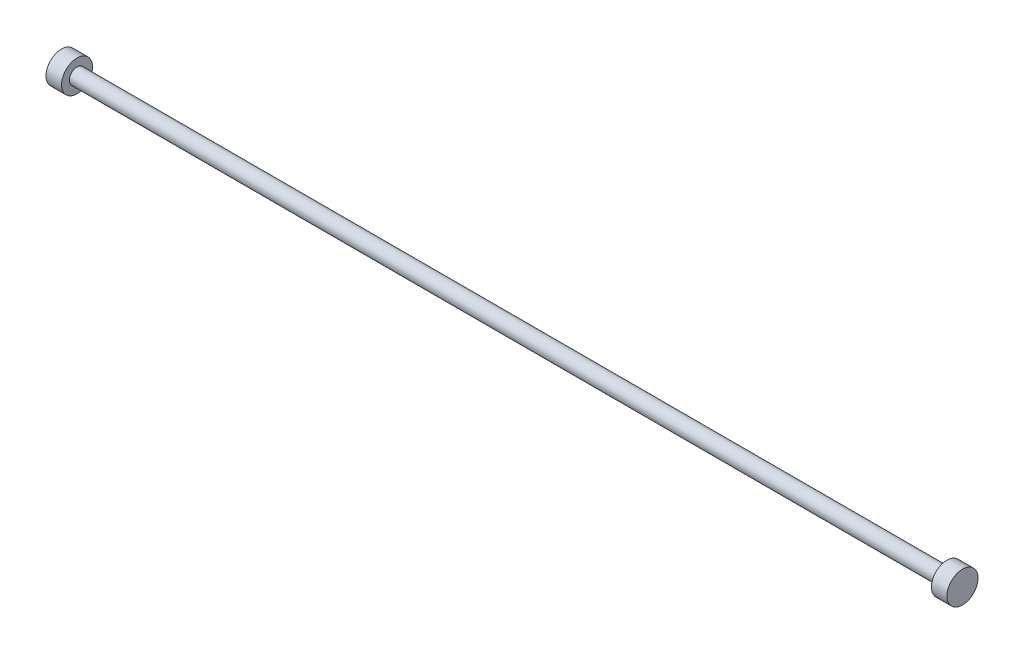
from build123d import *

# Parameters (mm, degrees)
SKETCH1_R           = 5
BOSS_EXTRUDE1_DEPTH = 560
SKETCH2_R           = 10
BOSS_EXTRUDE2_DEPTH = 10
BOSS_EXTRUDE3_START = 10
SKETCH3_R           = 10
BOSS_EXTRUDE3_DEPTH = 10


with BuildPart() as part:
    # Sketch1 → Boss-Extrude1 (new body)
    with BuildSketch(Plane(origin=(0, 0, 0), x_dir=(0, 0, -1), z_dir=(1, 0, 0))):
        Circle(SKETCH1_R)
    extrude(amount=BOSS_EXTRUDE1_DEPTH)

    # Sketch2 → Boss-Extrude2 (add)
    with BuildSketch(Plane(origin=(560, 0, 0), x_dir=(0, 0, -1), z_dir=(1, 0, 0))):
        Circle(SKETCH2_R)
    extrude(amount=BOSS_EXTRUDE2_DEPTH)

    # Sketch3 → Boss-Extrude3 (add)
    with BuildSketch(Plane.ZY.offset(BOSS_EXTRUDE3_START)):
        Circle(SKETCH3_R)
    extrude(amount=-BOSS_EXTRUDE3_DEPTH)


solid = part.part
